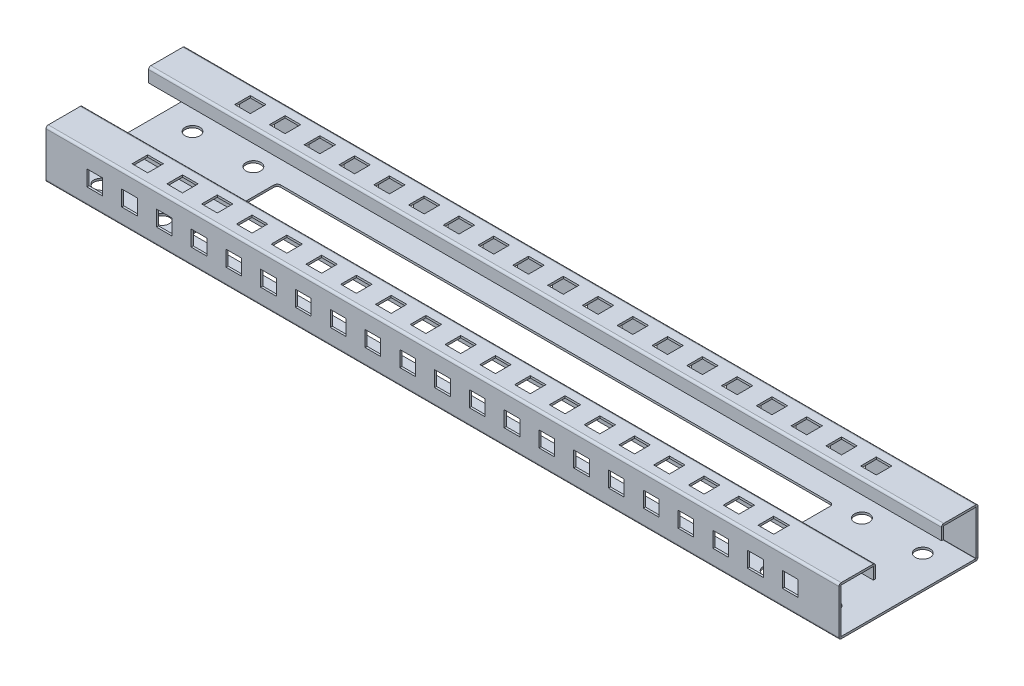
from build123d import *

# Parameters (mm, degrees)
SKETCH_1_W                         = 456
SKETCH_1_H                         = 80
SM_BASE_FLANGE_1_DEPTH             = 1.2
SM_EDGE_FLANGE_1_STRIP_W           = 5
SM_EDGE_FLANGE_1_STRIP_H           = 1.2
SM_EDGE_FLANGE_1_STRIP_CUT_DEPTH   = 456
SM_EDGE_FLANGE_1_STRIP_2_W         = 5
SM_EDGE_FLANGE_1_STRIP_2_H         = 1.2
SM_EDGE_FLANGE_1_STRIP_CUT_2_DEPTH = 456
SM_EDGE_FLANGE_1_DEPTH             = 456
SM_EDGE_FLANGE_1_BEND_DEPTH        = 456
SM_EDGE_FLANGE_2_STRIP_W           = 5
SM_EDGE_FLANGE_2_STRIP_H           = 1.2
SM_EDGE_FLANGE_2_STRIP_CUT_DEPTH   = 456
SM_EDGE_FLANGE_2_STRIP_2_W         = 5
SM_EDGE_FLANGE_2_STRIP_2_H         = 1.2
SM_EDGE_FLANGE_2_STRIP_CUT_2_DEPTH = 456
SM_EDGE_FLANGE_2_DEPTH             = 456
SM_EDGE_FLANGE_2_BEND_DEPTH        = 456
SKETCH_30_R                        = 4.25
SKETCH_30_W                        = 320
SKETCH_30_H                        = 50
CUT_EXTRUDE_1_DEPTH                = 10
SM_EDGE_FLANGE_3_STRIP_W           = 5
SM_EDGE_FLANGE_3_STRIP_H           = 1.2
SM_EDGE_FLANGE_3_STRIP_CUT_DEPTH   = 456
SM_EDGE_FLANGE_3_STRIP_2_W         = 5
SM_EDGE_FLANGE_3_STRIP_2_H         = 1.2
SM_EDGE_FLANGE_3_STRIP_CUT_2_DEPTH = 456
SM_EDGE_FLANGE_3_DEPTH             = 456
SM_EDGE_FLANGE_3_BEND_DEPTH        = 456
FILLET_1_R                         = 2
SKETCH_41_W                        = 9
SKETCH_41_H                        = 9
CUT_EXTRUDE_2_DEPTH                = 244.109522644
PATTERN_LINEAR_1_COUNT             = 11
PATTERN_LINEAR_1_PITCH             = 20
PATTERN_LINEAR_1_COUNT_DIR2        = 11
PATTERN_LINEAR_1_PITCH_DIR2        = 20
SKETCH_42_W                        = 9
SKETCH_42_H                        = 9
CUT_EXTRUDE_3_DEPTH                = 10
PATTERN_LINEAR_2_COUNT             = 10
PATTERN_LINEAR_2_PITCH             = 20
PATTERN_LINEAR_2_COL_COUNT         = 10
PATTERN_LINEAR_2_COL_PITCH         = 20


# Sheet-metal steps are written as plain solids
with BuildPart() as part:
    # Sketch 1 → 基体-法兰1 (new body)
    with BuildSketch(Plane(origin=(0, 0, 0), x_dir=(1, 0, 0), z_dir=(0, 1, 0))):
        Rectangle(SKETCH_1_W, SKETCH_1_H)
    extrude(amount=-SM_BASE_FLANGE_1_DEPTH)

    # 边线-法兰1 strip (across the edge) → 边线-法兰1 strip cut (cut)
    with BuildSketch(Plane(origin=(-228, 0, 40), x_dir=(0, 0, -1), z_dir=(1, 0, 0))):
        with Locations((-1.2, -0.6)):
            Rectangle(SM_EDGE_FLANGE_1_STRIP_W, SM_EDGE_FLANGE_1_STRIP_H)
    extrude(amount=SM_EDGE_FLANGE_1_STRIP_CUT_DEPTH, mode=Mode.SUBTRACT)

    # 边线-法兰1 strip 2 (across the edge) → 边线-法兰1 strip cut 2 (cut)
    with BuildSketch(Plane(origin=(228, 0, -40), x_dir=(0, 0, 1), z_dir=(-1, 0, 0))):
        with Locations((-1.2, -0.6)):
            Rectangle(SM_EDGE_FLANGE_1_STRIP_2_W, SM_EDGE_FLANGE_1_STRIP_2_H)
    extrude(amount=SM_EDGE_FLANGE_1_STRIP_CUT_2_DEPTH, mode=Mode.SUBTRACT)

    # 边线-法兰1 section (across the edge) → 边线-法兰1 (add)
    with BuildSketch(Plane(origin=(-228, 0, 40), x_dir=(0, 0, -1), z_dir=(1, 0, 0))):
        with BuildLine():
            Line((0, 0.1), (0, 26.8))
            Line((0, 26.8), (1.2, 26.8))
            Line((1.2, 26.8), (1.2, 0.1))
            ThreePointArc((1.2, 0.1), (1.229289322, 0.029289322), (1.3, 0))
            Line((1.3, 0), (1.3, -1.2))
            ThreePointArc((1.3, -1.2), (0.380761184, -0.819238816), (0, 0.1))
        make_face()
    extrude(amount=SM_EDGE_FLANGE_1_DEPTH)

    # 边线-法兰1 section 2 (across the edge) → 边线-法兰1 bend (add)
    with BuildSketch(Plane(origin=(228, 0, -40), x_dir=(0, 0, 1), z_dir=(-1, 0, 0))):
        with BuildLine():
            Line((0, 0.1), (0, 26.8))
            Line((0, 26.8), (1.2, 26.8))
            Line((1.2, 26.8), (1.2, 0.1))
            ThreePointArc((1.2, 0.1), (1.229289322, 0.029289322), (1.3, 0))
            Line((1.3, 0), (1.3, -1.2))
            ThreePointArc((1.3, -1.2), (0.380761184, -0.819238816), (0, 0.1))
        make_face()
    extrude(amount=SM_EDGE_FLANGE_1_BEND_DEPTH)

    # 边线-法兰2 strip (across the edge) → 边线-法兰2 strip cut (cut)
    with BuildSketch(Plane(origin=(-228, 26.8, 38.8), x_dir=(0, -1, 0), z_dir=(1, 0, 0))):
        with Locations((-1.2, -0.6)):
            Rectangle(SM_EDGE_FLANGE_2_STRIP_W, SM_EDGE_FLANGE_2_STRIP_H)
    extrude(amount=SM_EDGE_FLANGE_2_STRIP_CUT_DEPTH, mode=Mode.SUBTRACT)

    # 边线-法兰2 strip 2 (across the edge) → 边线-法兰2 strip cut 2 (cut)
    with BuildSketch(Plane(origin=(228, 26.8, -38.8), x_dir=(0, -1, 0), z_dir=(-1, 0, 0))):
        with Locations((-1.2, -0.6)):
            Rectangle(SM_EDGE_FLANGE_2_STRIP_2_W, SM_EDGE_FLANGE_2_STRIP_2_H)
    extrude(amount=SM_EDGE_FLANGE_2_STRIP_CUT_2_DEPTH, mode=Mode.SUBTRACT)

    # 边线-法兰2 section (across the edge) → 边线-法兰2 (add)
    with BuildSketch(Plane(origin=(-228, 26.8, 38.8), x_dir=(0, -1, 0), z_dir=(1, 0, 0))):
        with BuildLine():
            Line((0, 0.1), (0, 19.8))
            Line((0, 19.8), (1.2, 19.8))
            Line((1.2, 19.8), (1.2, 0.1))
            ThreePointArc((1.2, 0.1), (1.229289322, 0.029289322), (1.3, 0))
            Line((1.3, 0), (1.3, -1.2))
            ThreePointArc((1.3, -1.2), (0.380761184, -0.819238816), (0, 0.1))
        make_face()
    extrude(amount=SM_EDGE_FLANGE_2_DEPTH)

    # 边线-法兰2 section 2 (across the edge) → 边线-法兰2 bend (add)
    with BuildSketch(Plane(origin=(228, 26.8, -38.8), x_dir=(0, -1, 0), z_dir=(-1, 0, 0))):
        with BuildLine():
            Line((0, 0.1), (0, 19.8))
            Line((0, 19.8), (1.2, 19.8))
            Line((1.2, 19.8), (1.2, 0.1))
            ThreePointArc((1.2, 0.1), (1.229289322, 0.029289322), (1.3, 0))
            Line((1.3, 0), (1.3, -1.2))
            ThreePointArc((1.3, -1.2), (0.380761184, -0.819238816), (0, 0.1))
        make_face()
    extrude(amount=SM_EDGE_FLANGE_2_BEND_DEPTH)

    # 草图30 → 切除-拉伸1 (cut)
    with BuildSketch(Plane(origin=(0, 0, 0), x_dir=(1, 0, 0), z_dir=(0, 1, 0))):
        with Locations(Location((210, -26.25, 0), (0, 0, 270))):
            Circle(SKETCH_30_R)
        with Locations(Location((210, 26.25, 0), (0, 0, 270))):
            Circle(SKETCH_30_R)
        with Locations(Location((175, 26.25, 0), (0, 0, 270))):
            Circle(SKETCH_30_R)
        with Locations(Location((175, -26.25, 0), (0, 0, 270))):
            Circle(SKETCH_30_R)
        with Locations(Location((-210, 26.25, 0), (0, 0, 270))):
            Circle(SKETCH_30_R)
        with Locations(Location((-175, 26.25, 0), (0, 0, 270))):
            Circle(SKETCH_30_R)
        with Locations(Location((-210, -26.25, 0), (0, 0, 270))):
            Circle(SKETCH_30_R)
        with Locations(Location((-175, -26.25, 0), (0, 0, 270))):
            Circle(SKETCH_30_R)
        Rectangle(SKETCH_30_W, SKETCH_30_H)
    extrude(amount=-CUT_EXTRUDE_1_DEPTH, mode=Mode.SUBTRACT)

    # 边线-法兰3 strip (across the edge) → 边线-法兰3 strip cut (cut)
    with BuildSketch(Plane(origin=(-228, 25.6, 19), x_dir=(0, 0, 1), z_dir=(1, 0, 0))):
        with Locations((-1.2, -0.6)):
            Rectangle(SM_EDGE_FLANGE_3_STRIP_W, SM_EDGE_FLANGE_3_STRIP_H)
    extrude(amount=SM_EDGE_FLANGE_3_STRIP_CUT_DEPTH, mode=Mode.SUBTRACT)

    # 边线-法兰3 strip 2 (across the edge) → 边线-法兰3 strip cut 2 (cut)
    with BuildSketch(Plane(origin=(228, 25.6, -19), x_dir=(0, 0, -1), z_dir=(-1, 0, 0))):
        with Locations((-1.2, -0.6)):
            Rectangle(SM_EDGE_FLANGE_3_STRIP_2_W, SM_EDGE_FLANGE_3_STRIP_2_H)
    extrude(amount=SM_EDGE_FLANGE_3_STRIP_CUT_2_DEPTH, mode=Mode.SUBTRACT)

    # 边线-法兰3 section (across the edge) → 边线-法兰3 (add)
    with BuildSketch(Plane(origin=(-228, 25.6, 19), x_dir=(0, 0, 1), z_dir=(1, 0, 0))):
        with BuildLine():
            Line((0, 0.1), (0, 6.8))
            Line((0, 6.8), (1.2, 6.8))
            Line((1.2, 6.8), (1.2, 0.1))
            ThreePointArc((1.2, 0.1), (1.229289322, 0.029289322), (1.3, 0))
            Line((1.3, 0), (1.3, -1.2))
            ThreePointArc((1.3, -1.2), (0.380761184, -0.819238816), (0, 0.1))
        make_face()
    extrude(amount=SM_EDGE_FLANGE_3_DEPTH)

    # 边线-法兰3 section 2 (across the edge) → 边线-法兰3 bend (add)
    with BuildSketch(Plane(origin=(228, 25.6, -19), x_dir=(0, 0, -1), z_dir=(-1, 0, 0))):
        with BuildLine():
            Line((0, 0.1), (0, 6.8))
            Line((0, 6.8), (1.2, 6.8))
            Line((1.2, 6.8), (1.2, 0.1))
            ThreePointArc((1.2, 0.1), (1.229289322, 0.029289322), (1.3, 0))
            Line((1.3, 0), (1.3, -1.2))
            ThreePointArc((1.3, -1.2), (0.380761184, -0.819238816), (0, 0.1))
        make_face()
    extrude(amount=SM_EDGE_FLANGE_3_BEND_DEPTH)

    # 圆角1
    fillet_1_edges = [part.edges().sort_by_distance(p)[0] for p in [
        (160, -0.6, -25),
        (160, -0.6, 25),
        (-160, -0.6, 25),
        (-160, -0.6, -25),
    ]]
    fillet(fillet_1_edges, radius=FILLET_1_R)

    # 草图41 → 切除-拉伸2 (cut, through all)
    with BuildSketch(Plane.XY.offset(40)):
        with Locations((0, 12.8)):
            Rectangle(SKETCH_41_W, SKETCH_41_H)
    cut_extrude_2 = extrude(amount=-CUT_EXTRUDE_2_DEPTH, mode=Mode.SUBTRACT)

    # 阵列(线性)1: Cut-Extrude 2 11 × 11, 2 skipped
    with Locations(*[Vector(1, 0, 0) * (i * PATTERN_LINEAR_1_PITCH) + Vector(-1, 0, 0) * (j * PATTERN_LINEAR_1_PITCH_DIR2) for i in range(PATTERN_LINEAR_1_COUNT) for j in range(PATTERN_LINEAR_1_COUNT_DIR2) if (i, j) not in ((0, 0), (0, 9), (9, 0))]):
        add(cut_extrude_2, mode=Mode.SUBTRACT)

    # 草图42 → 切除-拉伸3 (cut)
    with BuildSketch(Plane(origin=(0, 26.8, 0), x_dir=(1, 0, 0), z_dir=(0, 1, 0))):
        with Locations((0, -29.5)):
            Rectangle(SKETCH_42_W, SKETCH_42_H)
        with Locations((0, 29.5)):
            Rectangle(SKETCH_42_W, SKETCH_42_H)
    cut_extrude_3 = extrude(amount=-CUT_EXTRUDE_3_DEPTH, mode=Mode.SUBTRACT)

    # 阵列(线性)2: 切除-拉伸3 ×10
    with Locations(*[(i * PATTERN_LINEAR_2_PITCH, 0, 0) for i in range(1, PATTERN_LINEAR_2_COUNT)]):
        add(cut_extrude_3, mode=Mode.SUBTRACT)

    # 阵列(线性)2 col: 切除-拉伸3 ×10
    with Locations(*[(-i * PATTERN_LINEAR_2_COL_PITCH, 0, 0) for i in range(1, PATTERN_LINEAR_2_COL_COUNT)]):
        add(cut_extrude_3, mode=Mode.SUBTRACT)


solid = part.part
